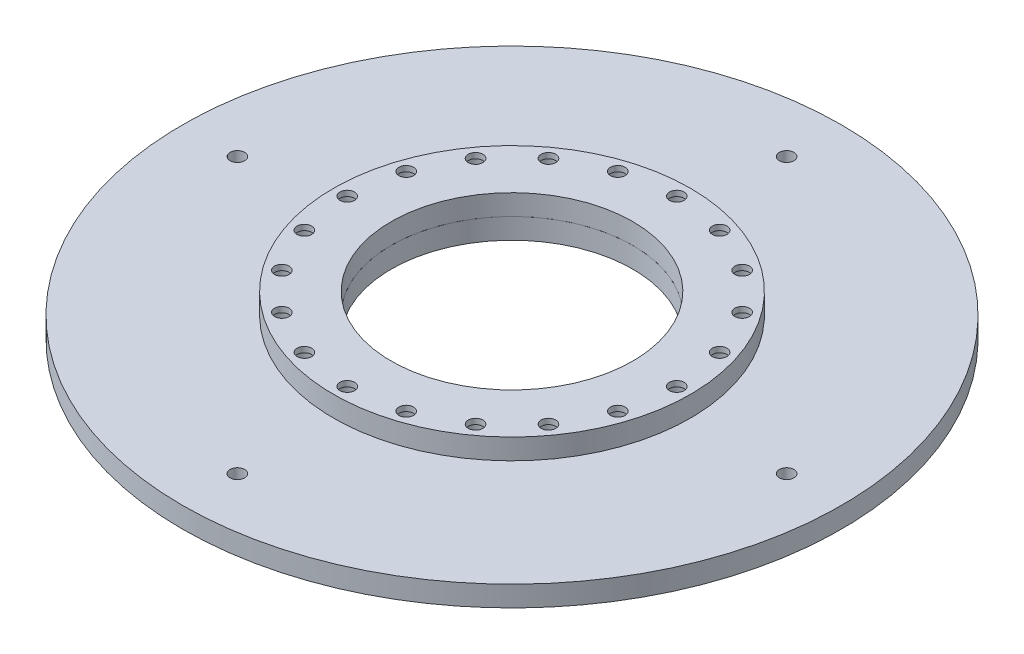
from build123d import *

# Parameters (mm, degrees)
SKETCH9_R                               = 82.55
SKETCH9_R_2                             = 55.88
REF_BACKPLATE_DEPTH                     = 9.525
REF_CBORE_BACKPLATE_D                   = 6.7564
REF_CBORE_BACKPLATE_CBORE_D             = 11.176
REF_CBORE_BACKPLATE_CBORE_DEPTH         = 6.985
REF_CBORE_BACKPLATE_PATTERN_COUNT       = 20
SKETCH1_R                               = 152.4
SKETCH1_R_2                             = 55.88
THRUSTPLATE_TC3_DEPTH                   = 9.525
SKETCH12_W                              = 3.3782
SKETCH12_H                              = 9.525
CLEARANCE_THRUSTPLATE_PATTERN_COUNT     = 4
SKETCH14_W                              = 3.175
SKETCH14_H                              = 9.525
UNDEF_CLEARANCE_BACKPLATE_PATTERN_COUNT = 10


with BuildPart() as part:
    # Sketch9 → REF_BackPlate (new body)
    with BuildSketch(Plane(origin=(0, 0, 0), x_dir=(1, 0, 0), z_dir=(0, 1, 0))):
        Circle(SKETCH9_R)
        Circle(SKETCH9_R_2, mode=Mode.SUBTRACT)
    extrude(amount=REF_BACKPLATE_DEPTH)

    # REF_CBORE_BackPlate (through all)
    with Locations(Plane(origin=(0, 0, 0), x_dir=(-1, 0, 0), z_dir=(0, -1, 0))):
        with Locations((0, 76.2)):
            ref_cbore_backplate = CounterBoreHole(REF_CBORE_BACKPLATE_D / 2, REF_CBORE_BACKPLATE_CBORE_D / 2, REF_CBORE_BACKPLATE_CBORE_DEPTH)

    # REF_CBORE_BackPlate_Pattern: REF_CBORE_BackPlate ×20 about axis
    ref_cbore_backplate_pattern_axis = Axis((0, 9.525, 0), (0, -1, 0))
    for i in range(1, REF_CBORE_BACKPLATE_PATTERN_COUNT):
        add(ref_cbore_backplate.rotate(ref_cbore_backplate_pattern_axis, i * 360 / REF_CBORE_BACKPLATE_PATTERN_COUNT), mode=Mode.SUBTRACT)


with BuildPart() as body_2:
    # Sketch1 → ThrustPlate_TC3 (new body)
    with BuildSketch(Plane(origin=(0, 0, 0), x_dir=(1, 0, 0), z_dir=(0, 1, 0))):
        Circle(SKETCH1_R)
        Circle(SKETCH1_R_2, mode=Mode.SUBTRACT)
    extrude(amount=-THRUSTPLATE_TC3_DEPTH)

    # Sketch12 → UNDEF_Clearance_ThrustPlate (revolve, cut)
    with BuildSketch(Plane(origin=(0, 0, -127), x_dir=(0, 0, 1), z_dir=(1, 0, 0))):
        with Locations((1.6891, 4.7625)):
            Rectangle(SKETCH12_W, SKETCH12_H)
    undef_clearance_thrustplate = revolve(axis=Axis((0, 6.35, -127), (0, -1, 0)), mode=Mode.SUBTRACT)

    # Clearance_ThrustPlate_Pattern: UNDEF_Clearance_ThrustPlate ×4 about axis
    clearance_thrustplate_pattern_axis = Axis((0, -9.525, 0), (0, 1, 0))
    for i in range(1, CLEARANCE_THRUSTPLATE_PATTERN_COUNT):
        add(undef_clearance_thrustplate.rotate(clearance_thrustplate_pattern_axis, i * 360 / CLEARANCE_THRUSTPLATE_PATTERN_COUNT), mode=Mode.SUBTRACT)

    # Sketch14 → UNDEF_Clearance_BackPlate (revolve, cut)
    with BuildSketch(Plane(origin=(10.26557861, 0, -64.814312495), x_dir=(0, 0, 1), z_dir=(1, 0, 0))):
        with Locations((1.5875, 4.7625)):
            Rectangle(SKETCH14_W, SKETCH14_H)
    undef_clearance_backplate = revolve(axis=Axis((10.26557861, 6.35, -64.814312495), (0, -1, 0)), mode=Mode.SUBTRACT)

    # UNDEF_Clearance_BackPlate_Pattern: UNDEF_Clearance_BackPlate ×10 about axis
    undef_clearance_backplate_pattern_axis = Axis((0, -9.525, 0), (0, 1, 0))
    for i in range(1, UNDEF_CLEARANCE_BACKPLATE_PATTERN_COUNT):
        add(undef_clearance_backplate.rotate(undef_clearance_backplate_pattern_axis, i * 360 / UNDEF_CLEARANCE_BACKPLATE_PATTERN_COUNT), mode=Mode.SUBTRACT)


solid = Compound([part.part, body_2.part])
